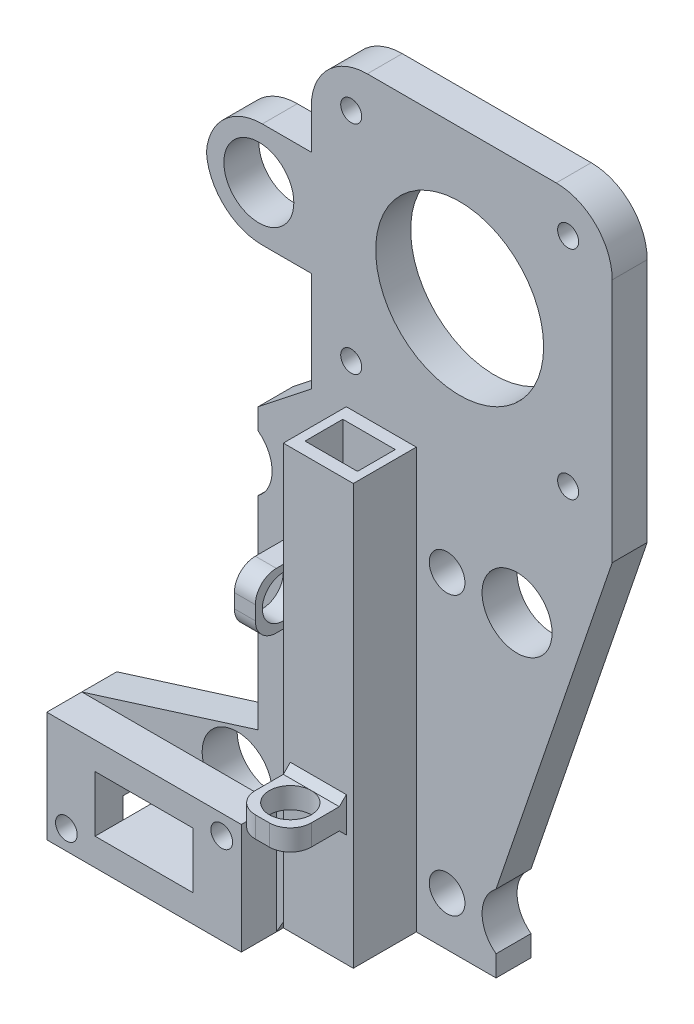
from build123d import *

# Parameters (mm, degrees)
SKETCH1_R            = 2.550000000000004
SKETCH1_R_2          = 2.5499999999999914
SKETCH1_R_3          = 2.5500000000000007
SKETCH1_R_4          = 2.550000000000003
BOSS_EXTRUDE1_DEPTH  = 5
BOSS_EXTRUDE2_DEPTH  = 9
BOSS_EXTRUDE3_DEPTH  = 5
BOSS_EXTRUDE4_DEPTH  = 5
SKETCH8_R            = 1.5000000000000009
SKETCH8_R_2          = 1.5000000000000042
SKETCH8_R_3          = 12.000000000000002
CUT_EXTRUDE3_DEPTH   = 115.84184777336179
BOSS_EXTRUDE5_START  = -5
BOSS_EXTRUDE5_DEPTH  = 5
FILLET1_R            = 8
BOSS_EXTRUDE7_START  = 5
BOSS_EXTRUDE7_DEPTH  = 5
CUT_EXTRUDE4_START   = -10
SKETCH12_R           = 1.5500000000000012
SKETCH12_R_2         = 1.5500000000000003
CUT_EXTRUDE4_DEPTH   = 10
SKETCH13_W           = 14.999999999999995
SKETCH13_H           = 15.000000000000043
SKETCH13_R           = 5.0000000000000036
BOSS_EXTRUDE8_DEPTH  = 5
FILLET2_R            = 8
CUT_EXTRUDE5_DEPTH   = 115.92454046025158
SKETCH15_W           = 7.5
SKETCH15_H           = 5.399999999999997
CUT_EXTRUDE6_DEPTH   = 60
SKETCH17_W           = 8
SKETCH17_H           = 7.999999999999998
SKETCH17_R           = 2.999999999999999
BOSS_EXTRUDE10_DEPTH = 3
FILLET4_R            = 3
CHAMFER1_SIZE        = 1
SKETCH18_W           = 8
SKETCH18_H           = 7.999999999999993
SKETCH18_R           = 3
BOSS_EXTRUDE11_DEPTH = 3
FILLET5_R            = 3
CHAMFER2_SIZE        = 1
CUT_EXTRUDE7_DEPTH   = 6


# Some blends are built 0.0001 mm under size
with BuildPart() as part:
    # Sketch1 → Boss-Extrude1 (new body)
    with BuildSketch(Plane.XY):
        with BuildLine():
            Line((0, 0), (33.99999999999999, 0))
            Line((33.99999999999999, 0), (33.99999999999999, 3.0000000000000107))
            ThreePointArc((33.99999999999999, 3.0000000000000107), (32.00000000000001, 7), (33.99999999999999, 10.99999999999999))
            Line((33.99999999999999, 10.99999999999999), (34, 42.7))
            ThreePointArc((34, 42.7), (32, 46.699999999999996), (34, 50.699999999999996))
            Line((34, 50.699999999999996), (34, 53.7))
            Line((34, 53.7), (0, 53.7))
            Line((0, 53.7), (-8.7e-16, 50.7))
            ThreePointArc((-8.7e-16, 50.7), (1.9999999999999938, 46.7), (-8.7e-16, 42.70000000000001))
            Line((-8.7e-16, 42.70000000000001), (-8.7e-16, 10.999999999999995))
            ThreePointArc((-8.7e-16, 10.999999999999995), (1.9999999999999973, 6.9999999999999964), (-8.7e-16, 2.9999999999999982))
            Line((-8.7e-16, 2.9999999999999982), (0, 0))
        make_face()
        with Locations((6.999999999999999, 46.7)):
            Circle(SKETCH1_R, mode=Mode.SUBTRACT)
        with Locations((27, 46.70000000000002)):
            Circle(SKETCH1_R_2, mode=Mode.SUBTRACT)
        with Locations((6.999999999999999, 6.999999999999997)):
            Circle(SKETCH1_R_3, mode=Mode.SUBTRACT)
        with Locations((27.000000000000004, 6.999999999999999)):
            Circle(SKETCH1_R_4, mode=Mode.SUBTRACT)
    extrude(amount=BOSS_EXTRUDE1_DEPTH)

    # Sketch2 → Boss-Extrude2 (add)
    with BuildSketch(Plane.XY.offset(5)):
        Polygon((22.599999999999994, 60), (22.6, 0), (12.600000000000001, 0), (12.599999999999998, 60), align=None)
    extrude(amount=BOSS_EXTRUDE2_DEPTH)

    # Sketch3 → Boss-Extrude3 (add)
    with BuildSketch(Plane.XY.offset(5)):
        Polygon((2.5999999999999983, 5.799999999999998), (2.5999999999999983, -10), (-25.200000000000003, -10.000000000000004), (-25.200000000000006, 5.799999999999998), align=None)
    extrude(amount=BOSS_EXTRUDE3_DEPTH)

    # Sketch6 → Boss-Extrude4 (add, through all)
    with BuildSketch(Plane.XY.offset(5)):
        Polygon((50.6, 102.70000000000002), (7.6, 102.70000000000002), (7.600000000000005, 59.70000000000002), (50.60000000000001, 59.70000000000002), align=None)
        Polygon((50.60000000000001, 59.70000000000002), (7.600000000000005, 59.70000000000002), (0, 53.7), (34, 53.7), align=None)
    extrude(amount=-BOSS_EXTRUDE4_DEPTH)

    # Sketch8 → Cut-Extrude3 (cut, through all)
    with BuildSketch(Plane.XY.offset(5)):
        with Locations((13.299999999999999, 97.00000000000001)):
            Circle(SKETCH8_R)
        with Locations((44.3, 97.00000000000001)):
            Circle(SKETCH8_R_2)
        with Locations((13.300000000000002, 66.00000000000001)):
            Circle(SKETCH8_R)
        with Locations((44.3, 66.00000000000001)):
            Circle(SKETCH8_R_2)
        with Locations((28.8, 81.50000000000001)):
            Circle(SKETCH8_R_3)
    extrude(amount=-CUT_EXTRUDE3_DEPTH, mode=Mode.SUBTRACT)

    # Sketch9 → Boss-Extrude5 (add)
    with BuildSketch(Plane.XY.offset(5).offset(BOSS_EXTRUDE5_START)):
        with BuildLine():
            Line((33.99999999999999, 10.999999999999986), (50.6, 59.70000000000002))
            Line((50.6, 59.70000000000002), (34, 53.7))
            Line((34, 53.7), (34, 50.699999999999996))
            ThreePointArc((34, 50.699999999999996), (39.236067977499786, 51.172135954999575), (42, 46.699999999999996))
            ThreePointArc((42, 46.699999999999996), (39.236067977499786, 42.227864045000416), (34, 42.7))
            Line((34, 42.7), (33.99999999999999, 10.99999999999999))
        make_face()
    extrude(amount=BOSS_EXTRUDE5_DEPTH)

    # Fillet1
    fillet1_edges = [part.edges().sort_by_distance(p)[0] for p in [
        (50.6, 102.70000000000002, 2.5),
        (7.6, 102.70000000000002, 2.5),
    ]]
    fillet(fillet1_edges, radius=FILLET1_R)

    # Sketch11 → Boss-Extrude7 (add)
    with BuildSketch(Plane(origin=(0, 0, 5), x_dir=(-1, 0, 0), z_dir=(0, 0, -1)).offset(BOSS_EXTRUDE7_START)):
        with BuildLine():
            Line((-2.5999999999999983, -10), (-8.37350269189618, 0))
            Line((-8.37350269189618, 0), (0, 0))
            Line((0, 0), (3.47e-15, 2.9999999999999982))
            ThreePointArc((3.47e-15, 2.9999999999999982), (7.999999999999998, 6.9999999999999964), (8.7e-16, 10.999999999999995))
            Line((8.7e-16, 10.999999999999995), (3.52e-15, 13.705401938363094))
            Line((3.52e-15, 13.705401938363094), (25.200000000000006, 5.799999999999998))
            Line((25.200000000000006, 5.799999999999998), (25.200000000000003, -10.000000000000004))
            Line((25.200000000000003, -10.000000000000004), (-2.5999999999999983, -10))
        make_face()
    extrude(amount=-BOSS_EXTRUDE7_DEPTH)

    # Sketch12 → Cut-Extrude4 (cut)
    with BuildSketch(Plane.XY.offset(10).offset(CUT_EXTRUDE4_START)):
        with Locations((-22.400000000000006, -7.2)):
            Circle(SKETCH12_R)
        with Locations((-0.20000000000000182, 2.999999999999998)):
            Circle(SKETCH12_R_2)
    extrude(amount=CUT_EXTRUDE4_DEPTH, mode=Mode.SUBTRACT)

    # Sketch13 → Boss-Extrude8 (add)
    with BuildSketch(Plane.XY.offset(5)):
        with Locations((0.09999999999999964, 81.50000000000003)):
            Rectangle(SKETCH13_W, SKETCH13_H)
        with Locations((0.09999999999999969, 81.50000000000001)):
            Circle(SKETCH13_R, mode=Mode.SUBTRACT)
    extrude(amount=-BOSS_EXTRUDE8_DEPTH)

    # Fillet2
    # the kernel refuses this fillet: 8 mm, written as the material it takes off along each edge
    with BuildSketch(Plane(origin=(-7.399999999999999, 74, 25), x_dir=(1, 0, 0), z_dir=(0, 0, -1))) as fillet2_piece_1:
        with BuildLine():
            CenterArc((FILLET2_R, -FILLET2_R), FILLET2_R, 90, 90)
            Line((-8.9e-16, -FILLET2_R), (0, 0))
            Line((0, 0), (FILLET2_R, 0))
        make_face()
    extrude(amount=45, mode=Mode.SUBTRACT)
    with BuildSketch(Plane(origin=(-7.399999999999999, 89.00000000000004, 25), x_dir=(1, 0, 0), z_dir=(0, 0, -1))) as fillet2_piece_2:
        with BuildLine():
            CenterArc((FILLET2_R, FILLET2_R), FILLET2_R, 180, 90)
            Line((-8.9e-16, FILLET2_R), (0, 0))
            Line((0, 0), (FILLET2_R, 0))
        make_face()
    extrude(amount=45, mode=Mode.SUBTRACT)

    # Sketch14 → Cut-Extrude5 (cut, through all)
    with BuildSketch(Plane.XY.offset(10)):
        Polygon((-18.300000000000004, 1.8999999999999955), (-4.300000000000003, 1.8999999999999972), (-4.300000000000003, -6.1), (-18.300000000000004, -6.100000000000001), align=None)
    extrude(amount=-CUT_EXTRUDE5_DEPTH, mode=Mode.SUBTRACT)

    # Sketch15 → Cut-Extrude6 (cut)
    with BuildSketch(Plane.XZ):
        with Locations((17.65, 9.5)):
            Rectangle(SKETCH15_W, SKETCH15_H)
    extrude(amount=-CUT_EXTRUDE6_DEPTH, mode=Mode.SUBTRACT)

    # Sketch17 → Boss-Extrude10 (add)
    with BuildSketch(Plane(origin=(0, 20, 0), x_dir=(-1, 0, 0), z_dir=(0, -1, 0))):
        with Locations((-17.6, -18)):
            Rectangle(SKETCH17_W, SKETCH17_H)
        with Locations(Location((-17.6, -18, 0), (0, 0, 90))):
            Circle(SKETCH17_R, mode=Mode.SUBTRACT)
    extrude(amount=BOSS_EXTRUDE10_DEPTH)

    # Fillet4
    fillet4_edges = [part.edges().sort_by_distance(p)[0] for p in [
        (21.6, 18.5, 22),
        (13.600000000000001, 18.5, 22),
    ]]
    fillet(fillet4_edges, radius=FILLET4_R)

    # Chamfer1
    chamfer1_edges = [part.edges().sort_by_distance(p)[0] for p in [
        (17.6, 17, 14.000000000000002),
        (17.6, 20, 14.000000000000002),
    ]]
    chamfer(chamfer1_edges, length=CHAMFER1_SIZE - 0.0001)  # a hair under: the kernel refuses the full size

    # Sketch18 → Boss-Extrude11 (add)
    with BuildSketch(Plane.ZY.offset(-7.600000000000001)):
        with Locations((9.000000000000002, 35.999999999999986)):
            Rectangle(SKETCH18_W, SKETCH18_H)
        with Locations(Location((9.000000000000002, 35.99999999999999, 0), (0, 0, 270))):
            Circle(SKETCH18_R, mode=Mode.SUBTRACT)
    extrude(amount=BOSS_EXTRUDE11_DEPTH)

    # Fillet5
    fillet5_edges = [part.edges().sort_by_distance(p)[0] for p in [
        (6.1, 31.999999999999993, 13.000000000000002),
        (6.099999999999999, 39.999999999999986, 13.000000000000002),
    ]]
    fillet(fillet5_edges, radius=FILLET5_R)

    # Chamfer2
    chamfer2_edges = [part.edges().sort_by_distance(p)[0] for p in [
        (4.6, 35.999999999999986, 5.000000000000001),
        (7.6, 35.999999999999986, 5.000000000000001),
        (6.099999999999999, 39.999999999999986, 5.000000000000001),
        (6.1, 31.999999999999993, 5.000000000000001),
    ]]
    chamfer(chamfer2_edges, length=CHAMFER2_SIZE)

    # Sketch19 → Cut-Extrude7 (cut)
    with BuildSketch(Plane(origin=(0, 0, 0), x_dir=(-1, 0, 0), z_dir=(0, 0, -1))):
        Polygon((25.200000000000003, -10.000000000000004), (18.300000000000004, -10.000000000000004), (18.300000000000008, -3.1000000000000036), (25.200000000000006, -3.1000000000000028), align=None)
    extrude(amount=-CUT_EXTRUDE7_DEPTH, mode=Mode.SUBTRACT)


solid = part.part
